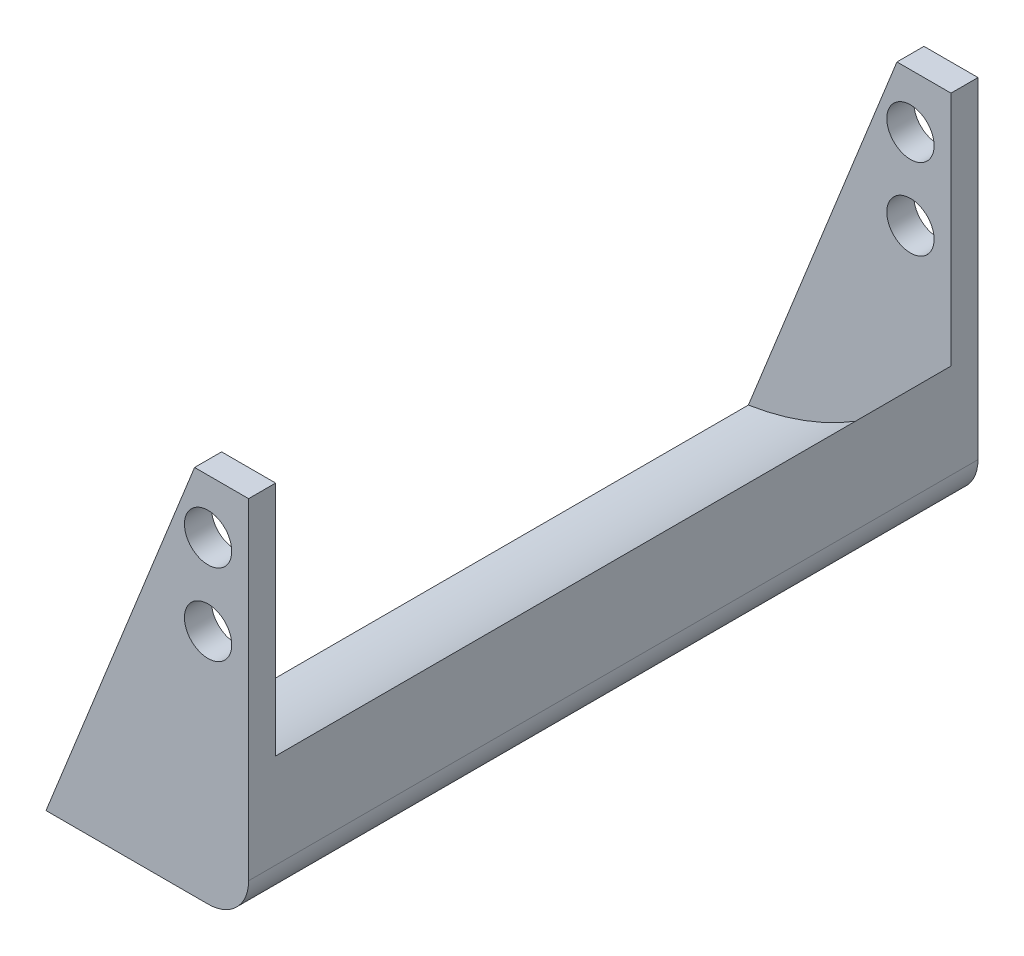
from build123d import *

# Parameters (mm, degrees)
BOSS_EXTRUDE1_DEPTH = 25
SKETCH2_R           = 1.75
BOSS_EXTRUDE2_DEPTH = 2
FILLET1_R           = 3


with BuildPart() as part:
    # Sketch1 → Boss-Extrude1 (new, symmetric)
    with BuildSketch(Plane.XY):
        with BuildLine():
            Line((0, 0), (15, 0))
            Line((15, 0), (15, 10))
            ThreePointArc((15, 10), (8.598738336, 3.351892496), (0, 0))
        make_face()
    extrude(amount=BOSS_EXTRUDE1_DEPTH, both=True)

    # Sketch2 → Boss-Extrude2 (add)
    with BuildSketch(Plane.XY.offset(25)):
        Polygon((15, 0), (15, 27.5), (11, 27.5), (0, 0), align=None)
        with Locations((12, 23.5)):
            Circle(SKETCH2_R, mode=Mode.SUBTRACT)
        with Locations((12, 17.5)):
            Circle(SKETCH2_R, mode=Mode.SUBTRACT)
    boss_extrude2 = extrude(amount=BOSS_EXTRUDE2_DEPTH)

    # Mirror1: Boss-Extrude2 across plane
    add(boss_extrude2.mirror(Plane.XY))

    # Fillet1
    fillet1_edges = [part.edges().sort_by_distance(p)[0] for p in [
        (15, 0, 0),
    ]]
    fillet(fillet1_edges, radius=FILLET1_R)


solid = part.part
